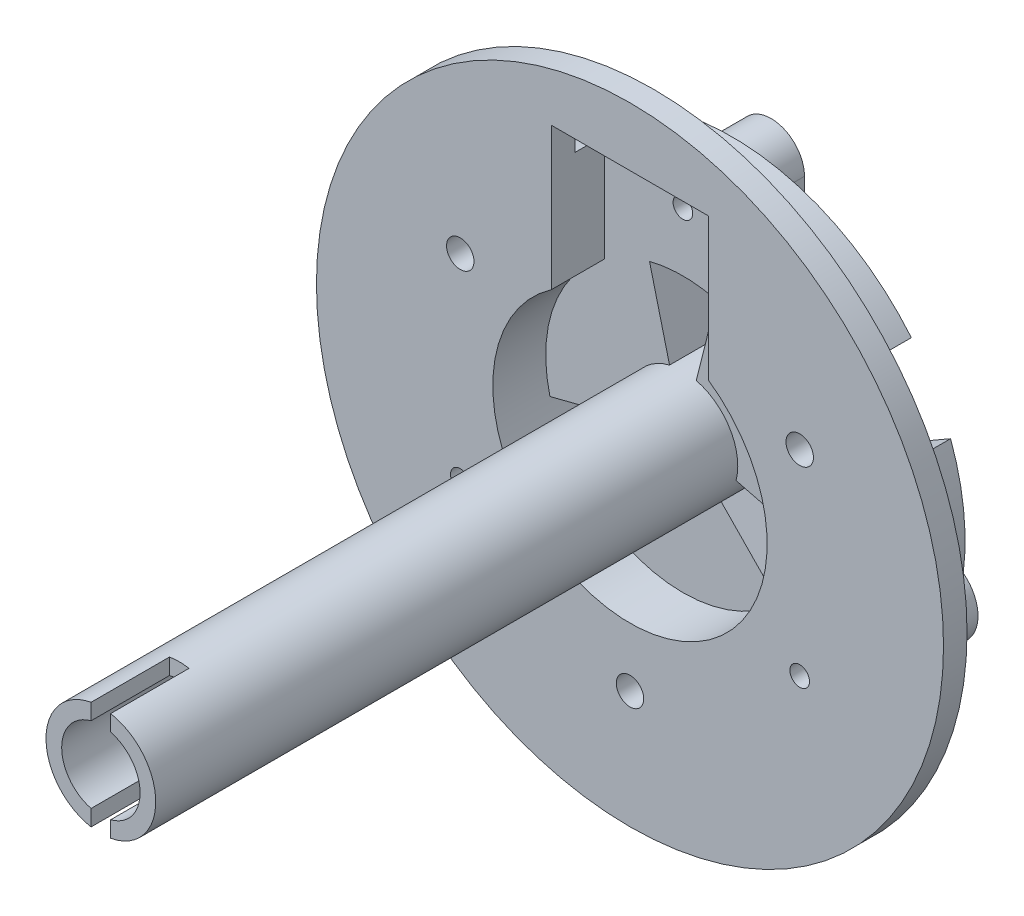
from build123d import *
from build123d.topology import SkipClean

# Parameters (mm, degrees)
SKETCH_1_R           = 16
EXTRUDE_1_DEPTH      = 1.2
SKETCH_2_R           = 7
CUT_EXTRUDE_1_DEPTH  = 1.2
SKETCH_3_R           = 0.7
CUT_EXTRUDE_2_DEPTH  = 1.2
SKETCH_4_R           = 0.9
EXTRUDE_2_DEPTH      = 6
SKETCH_5_R           = 7
CUT_EXTRUDE_3_DEPTH  = 11
SKETCH_6_R           = 11.9
SKETCH_6_R_2         = 7
EXTRUDE_3_DEPTH      = 4
SKETCH_7_R           = 0.7
CUT_EXTRUDE_4_DEPTH  = 13
SKETCH_8_R           = 2.8
EXTRUDE_4_DEPTH      = 33
EXTRUDE_START        = -2.5
EXTRUDE_5_DEPTH      = 2.5
SKETCH_10_R          = 1.5
CUT_EXTRUDE_5_DEPTH  = 33.5
SKETCH_12_W          = 13.813743992
SKETCH_12_H          = 10.461201588
CUT_EXTRUDE_6_DEPTH  = 16.75
SKETCH_13_R          = 2
CUT_EXTRUDE_7_DEPTH  = 1.5
SKETCH_14_R          = 2.8
SKETCH_14_R_2        = 2
EXTRUDE_6_DEPTH      = 8.25
CUT_EXTRUDE_9_DEPTH  = 1.5
EXTRUDE_START_2      = -32.2
SKETCH_17_R          = 1.5
SKETCH_17_R_2        = 1.48
EXTRUDE_7_DEPTH      = 32.2
CUT_EXTRUDE_8_DEPTH  = 4
CUT_EXTRUDE_10_DEPTH = 2.7
SKETCH_19_R          = 0.5
CUT_EXTRUDE_11_DEPTH = 10
CUT_EXTRUDE_START    = -45
SKETCH_20_R          = 2
CUT_EXTRUDE_12_DEPTH = 45


with BuildPart() as part:
    # 草图1 → 凸台-拉伸1 (new body)
    with BuildSketch(Plane.XY):
        Circle(SKETCH_1_R)
    extrude(amount=EXTRUDE_1_DEPTH)

    # 草图2 → 切除-拉伸1 (cut)
    with BuildSketch(Plane.XY.offset(1.2)):
        Circle(SKETCH_2_R)
    extrude(amount=-CUT_EXTRUDE_1_DEPTH, mode=Mode.SUBTRACT)

    # 草图3 → 切除-拉伸2 (cut)
    with BuildSketch(Plane.XY.offset(1.2)):
        with Locations((8.660254038, 5)):
            Circle(SKETCH_3_R)
        with Locations((0, -10)):
            Circle(SKETCH_3_R)
        with Locations((-8.660254038, 5)):
            Circle(SKETCH_3_R)
    extrude(amount=-CUT_EXTRUDE_2_DEPTH, mode=Mode.SUBTRACT)

    # 草图4 → 凸台-拉伸2 (add)
    # profile 1 of 3: a face of its own
    with BuildSketch(Plane(origin=(0, 0, 0), x_dir=(-1, 0, 0), z_dir=(0, 0, -1))):
        with BuildLine():
            Line((1.703894623, 10), (1.703894623, 5.395195442))
            Line((1.703894623, 5.395195442), (-1.703894623, 5.395195442))
            Line((-1.703894623, 5.395195442), (-1.703894623, 10))
            ThreePointArc((-1.703894623, 10), (0, 11.703894623), (1.703894623, 10))
        make_face()
        with Locations((0, 10)):
            Circle(SKETCH_4_R, mode=Mode.SUBTRACT)
    # profile 2 of 3: a face of its own
    with BuildSketch(Plane(origin=(0, 0, 0), x_dir=(-1, 0, 0), z_dir=(0, 0, -1))):
        with BuildLine():
            Line((-5.537946003, -1.003403593), (-3.637946003, -4.294300127))
            Line((-3.637946003, -4.294300127), (-7.710254038, -6.645448267))
            ThreePointArc((-7.710254038, -6.645448267), (-10.305702305, -5.95), (-9.610254038, -3.354551733))
            Line((-9.610254038, -3.354551733), (-5.537946003, -1.003403593))
        make_face()
        with Locations((-8.660254038, -5)):
            Circle(SKETCH_4_R, mode=Mode.SUBTRACT)
    # profile 3 of 3: a face of its own
    with BuildSketch(Plane(origin=(0, 0, 0), x_dir=(-1, 0, 0), z_dir=(0, 0, -1))):
        with BuildLine():
            Line((3.637946003, -4.294300127), (5.537946003, -1.003403593))
            Line((5.537946003, -1.003403593), (9.610254038, -3.354551733))
            ThreePointArc((9.610254038, -3.354551733), (10.305702305, -5.95), (7.710254038, -6.645448267))
            Line((7.710254038, -6.645448267), (3.637946003, -4.294300127))
        make_face()
        with Locations((8.660254038, -5)):
            Circle(SKETCH_4_R, mode=Mode.SUBTRACT)
    extrude(amount=EXTRUDE_2_DEPTH)

    # 草图5 → 切除-拉伸3 (cut)
    with BuildSketch(Plane.XY.offset(1.2)):
        Circle(SKETCH_5_R)
    extrude(amount=-CUT_EXTRUDE_3_DEPTH, mode=Mode.SUBTRACT)

    # 草图6 → 凸台-拉伸3 (add)
    with SkipClean():  # the faces are left unmerged after this step: merging them gives an invalid solid
        with BuildSketch(Plane(origin=(0, 0, 0), x_dir=(-1, 0, 0), z_dir=(0, 0, -1))):
            Circle(SKETCH_6_R)
            Circle(SKETCH_6_R_2, mode=Mode.SUBTRACT)
        extrude(amount=EXTRUDE_3_DEPTH)

    # 草图7 → 切除-拉伸4 (cut)
    with SkipClean():  # the faces are left unmerged after this step: merging them gives an invalid solid
        with BuildSketch(Plane.XY.offset(1.2)):
            with Locations((-8.660254038, 5)):
                Circle(SKETCH_7_R)
            with Locations((8.660254038, 5)):
                Circle(SKETCH_7_R)
            with Locations((0, -10)):
                Circle(SKETCH_7_R)
        extrude(amount=-CUT_EXTRUDE_4_DEPTH, mode=Mode.SUBTRACT)



with BuildPart() as body_2:
    # 草图8 → 凸台-拉伸4 (new body)
    with BuildSketch(Plane(origin=(0, 0, -4), x_dir=(-1, 0, 0), z_dir=(0, 0, -1))):
        Circle(SKETCH_8_R)
    extrude(amount=-EXTRUDE_4_DEPTH)


with BuildPart() as part_1:
    with SkipClean():  # the faces are left unmerged after this step: merging them gives an invalid solid
        add(part.part)

        add(body_2.part)  # 凸台-拉伸5 merges body 2
        # 草图9 → 凸台-拉伸5 (add)
        with BuildSketch(Plane(origin=(0, 0, -4), x_dir=(-1, 0, 0), z_dir=(0, 0, -1)).offset(EXTRUDE_START)):
            with BuildLine():
                Line((-1.570048426, -1.611659996), (-4.884595102, -5.01405332))
                ThreePointArc((-4.884595102, -5.01405332), (0, -7), (4.884595102, -5.01405332))
                Line((4.884595102, -5.01405332), (1.570048426, -1.611659996))
                ThreePointArc((1.570048426, -1.611659996), (0, -2.25), (-1.570048426, -1.611659996))
            make_face()
            with BuildLine():
                Line((-2.180762711, -0.553871824), (-6.784595102, -1.723156785))
                ThreePointArc((-6.784595102, -1.723156785), (-6.010804278, 3.587510548), (-1.703894623, 6.789458234))
                Line((-1.703894623, 6.789458234), (-0.547680415, 2.182325861))
                ThreePointArc((-0.547680415, 2.182325861), (-1.932044232, 1.15312839), (-2.180762711, -0.553871824))
            make_face()
            with BuildLine():
                Line((0.547680415, 2.182325861), (1.703894623, 6.789458234))
                ThreePointArc((1.703894623, 6.789458234), (6.010804278, 3.587510548), (6.784595102, -1.723156785))
                Line((6.784595102, -1.723156785), (2.180762711, -0.553871824))
                ThreePointArc((2.180762711, -0.553871824), (1.932044232, 1.15312839), (0.547680415, 2.182325861))
            make_face()
        extrude(amount=EXTRUDE_5_DEPTH)

    # 草图10 → 切除-拉伸5 (cut)
    with SkipClean():  # the faces are left unmerged after this step: merging them gives an invalid solid
        with BuildSketch(Plane(origin=(0, 0, -4), x_dir=(-1, 0, 0), z_dir=(0, 0, -1))):
            Circle(SKETCH_10_R)
        extrude(amount=-CUT_EXTRUDE_5_DEPTH, mode=Mode.SUBTRACT)

    # 草图12 → 切除-拉伸6 (cut, symmetric)
    with SkipClean():  # the faces are left unmerged after this step: merging them gives an invalid solid
        with BuildSketch(Plane(origin=(0, 0, 0), x_dir=(0, 0, -1), z_dir=(1, 0, 0))):
            with Locations((-26.856871996, 0.140862114)):
                Rectangle(SKETCH_12_W, SKETCH_12_H)
        extrude(amount=CUT_EXTRUDE_6_DEPTH, both=True, mode=Mode.SUBTRACT)

    # 草图13 → 切除-拉伸7 (cut)
    with SkipClean():  # the faces are left unmerged after this step: merging them gives an invalid solid
        with BuildSketch(Plane(origin=(0, 0, -4), x_dir=(-1, 0, 0), z_dir=(0, 0, -1))):
            with Locations((0, -10)):
                Circle(SKETCH_13_R)
            with Locations((8.660254038, 5)):
                Circle(SKETCH_13_R)
            with Locations((-8.660254038, 5)):
                Circle(SKETCH_13_R)
        extrude(amount=-CUT_EXTRUDE_7_DEPTH, mode=Mode.SUBTRACT)

    # 草图14 → 凸台-拉伸6 (add)
    with SkipClean():  # the faces are left unmerged after this step: merging them gives an invalid solid
        with BuildSketch(Plane.XY.offset(19.95)):
            Circle(SKETCH_14_R)
            Circle(SKETCH_14_R_2, mode=Mode.SUBTRACT)
        extrude(amount=EXTRUDE_6_DEPTH)

    # 草图16 → 切除-拉伸9 (cut)
    with SkipClean():  # the faces are left unmerged after this step: merging them gives an invalid solid
        with BuildSketch(Plane(origin=(0, 0, -4), x_dir=(-1, 0, 0), z_dir=(0, 0, -1))):
            Polygon((0, -10), (-2, -10), (-2, -14.130337011), (2, -14.130337011), (2, -10), align=None)
            Polygon((-9.660254038, 3.267949192), (-8.660254038, 5), (-7.660254038, 6.732050808), (-11.237230815, 8.797219313), (-13.237230815, 5.333117698), align=None)
            Polygon((7.660254038, 6.732050808), (8.660254038, 5), (9.660254038, 3.267949192), (13.237230815, 5.333117698), (11.237230815, 8.797219313), align=None)
        extrude(amount=-CUT_EXTRUDE_9_DEPTH, mode=Mode.SUBTRACT)

    # 草图17 → 凸台-拉伸7 (add)
    with SkipClean():  # the faces are left unmerged after this step: merging them gives an invalid solid
        with BuildSketch(Plane.XY.offset(28.2).offset(EXTRUDE_START_2)):
            Circle(SKETCH_17_R)
            Circle(SKETCH_17_R_2, mode=Mode.SUBTRACT)
        extrude(amount=EXTRUDE_7_DEPTH)

    # 草图15 → 切除-拉伸8 (cut)
    with SkipClean():  # the faces are left unmerged after this step: merging them gives an invalid solid
        with BuildSketch(Plane.XY.offset(28.2)):
            Polygon((0.5, 0), (0.5, 3.091484403), (-0.5, 3.091484403), (-0.5, -2.900632705), (0.5, -2.900632705), align=None)
        extrude(amount=-CUT_EXTRUDE_8_DEPTH, mode=Mode.SUBTRACT)

    # 草图18 → 切除-拉伸10 (cut)
    with SkipClean():  # the faces are left unmerged after this step: merging them gives an invalid solid
        with BuildSketch(Plane.XY.offset(1.2)):
            Polygon((0, 13), (-4, 13), (-4, 4.729732775), (4, 4.729732775), (4, 13), align=None)
        extrude(amount=-CUT_EXTRUDE_10_DEPTH, mode=Mode.SUBTRACT)

    # 草图19 → 切除-拉伸11 (cut)
    with SkipClean():  # the faces are left unmerged after this step: merging them gives an invalid solid
        with BuildSketch(Plane(origin=(0, 0, -6), x_dir=(-1, 0, 0), z_dir=(0, 0, -1))):
            with Locations((-8.660254038, -5)):
                Circle(SKETCH_19_R)
            with Locations((0, 10)):
                Circle(SKETCH_19_R)
            with Locations((8.660254038, -5)):
                Circle(SKETCH_19_R)
        extrude(amount=-CUT_EXTRUDE_11_DEPTH, mode=Mode.SUBTRACT)

    # 草图20 → 切除-拉伸12 (cut)
    with SkipClean():  # the faces are left unmerged after this step: merging them gives an invalid solid
        with BuildSketch(Plane.XY.offset(28.2).offset(CUT_EXTRUDE_START)):
            Circle(SKETCH_20_R)
        extrude(amount=CUT_EXTRUDE_12_DEPTH, mode=Mode.SUBTRACT)


solid = part_1.part
